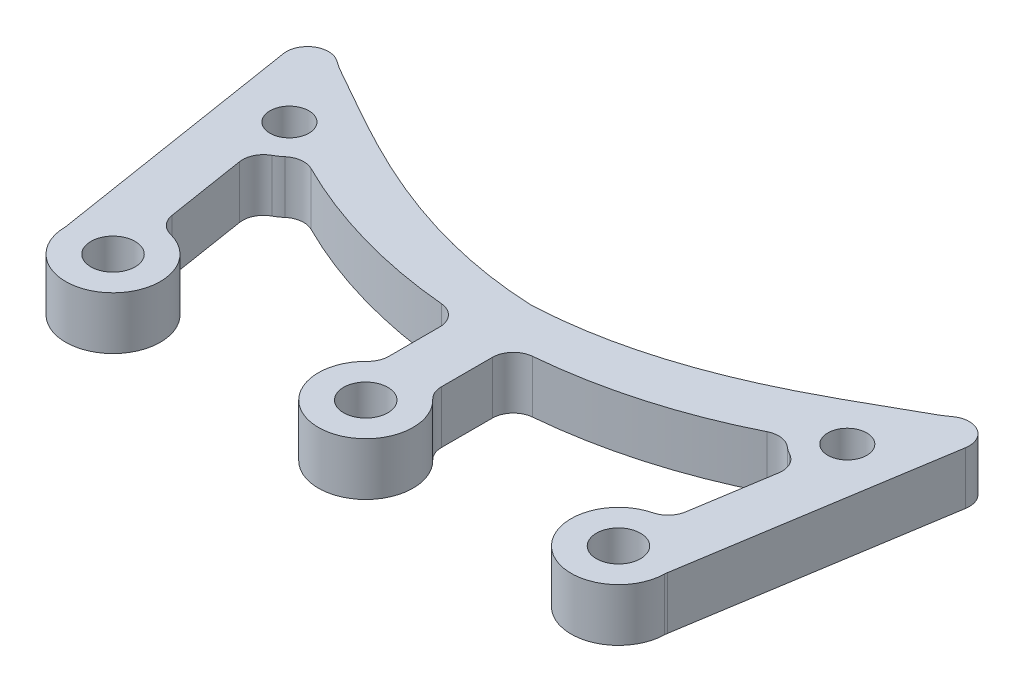
from build123d import *

# Parameters (mm, degrees)
SKETCH1_R           = 2.1
SKETCH1_R_2         = 1.85
BOSS_EXTRUDE1_DEPTH = 5
FILLET1_R           = 2


with BuildPart() as part:
    # Sketch1 → Boss-Extrude1 (new body)
    with BuildSketch(Plane(origin=(0, 0, 0), x_dir=(1, 0, 0), z_dir=(0, 1, 0))):
        with BuildLine():
            Line((64.703578791, 22.153935156), (60.086593503, -6.943643112))
            ThreePointArc((60.086593503, -6.943643112), (52.351867725, -10.071989183), (55.737016108, -2.446157921))
            Line((55.737016108, -2.446157921), (57.44284906, 8.304495315))
            ThreePointArc((57.44284906, 8.304495315), (55.811241442, 8.948588976), (54.605866, 10.222979068))
            ThreePointArc((54.605866, 10.222979068), (44.668654946, 6.187635781), (34.085703384, 4.445999995))
            Line((34.085703384, 4.445999995), (34.085703384, -3.201391143))
            ThreePointArc((34.085703384, -3.201391143), (31.586593503, -11.443643112), (29.087483622, -3.201391143))
            Line((29.087483622, -3.201391143), (29.087483622, 4.445999995))
            ThreePointArc((29.087483622, 4.445999995), (18.504532059, 6.187635781), (8.567321006, 10.222979068))
            ThreePointArc((8.567321006, 10.222979068), (7.361945564, 8.948588976), (5.730337946, 8.304495315))
            Line((5.730337946, 8.304495315), (7.436170898, -2.446157921))
            ThreePointArc((7.436170898, -2.446157921), (10.821319281, -10.071989183), (3.086593503, -6.943643112))
            Line((3.086593503, -6.943643112), (-1.530391785, 22.153935156))
            Line((-1.530391785, 22.153935156), (3.086593503, 19.066758984))
            add(Edge.make_bspline(
                [(3.086593503, 19.066758984), (6.214599524, 17.320565922), (15.289655428, 11.953978367), (24.991497583, 9.011909138), (31.586593503, 8.723848672)],
                knots=[0.224841934, 0.224841934, 0.224841934, 0.224841934, 0.497996304, 1, 1, 1, 1], degree=3))
            add(Edge.make_bspline(
                [(60.086593503, 19.066758984), (56.958587482, 17.320565922), (47.883531578, 11.953978367), (38.181689422, 9.011909138), (31.586593503, 8.723848672)],
                knots=[0.224841934, 0.224841934, 0.224841934, 0.224841934, 0.497996304, 1, 1, 1, 1], degree=3))
            Line((60.086593503, 19.066758984), (64.703578791, 22.153935156))
        make_face()
        with Locations(Location((7.586593503, -6.943643112, 0), (0, 0, 270))):
            Circle(SKETCH1_R, mode=Mode.SUBTRACT)
        with Locations(Location((55.586593503, -6.943643112, 0), (0, 0, 90))):
            Circle(SKETCH1_R, mode=Mode.SUBTRACT)
        with Locations(Location((31.586593503, -6.943643112, 0), (0, 0, 270))):
            Circle(SKETCH1_R, mode=Mode.SUBTRACT)
        with Locations(Location((5.096599352, 12.298499455, 0), (0, 0, 270))):
            Circle(SKETCH1_R_2, mode=Mode.SUBTRACT)
        with Locations(Location((58.076587654, 12.298499455, 0), (0, 0, 270))):
            Circle(SKETCH1_R_2, mode=Mode.SUBTRACT)
    extrude(amount=BOSS_EXTRUDE1_DEPTH)

    # Fillet1
    # the kernel refuses this fillet: 2 mm, written as the material it adds along each edge
    with BuildSketch(Plane(origin=(60.086593503, 0, 6.943643112), x_dir=(0.15671199054579144, 0, -0.9876443449031517), z_dir=(0, 1, 0))) as fillet1_piece_1:
        with BuildLine():
            CenterArc((0.14315588, -2), FILLET1_R, 90, 7.499462887)
            ThreePointArc((-0.117877916, -0.01710783), (-0.058882351, -0.008943954), (0, 0))
            Line((0, 0), (0.14315588, 0))
        make_face()
    extrude(amount=5)
    with BuildSketch(Plane(origin=(55.737016108, 0, 2.446157921), x_dir=(-0.9943134943930577, 0, 0.1064926047566996), z_dir=(0, 1, 0))) as fillet1_piece_2:
        with BuildLine():
            CenterArc((1.536372783, -1.980396143), FILLET1_R, 98.028765666, 66.841966003)
            Line((-0.39430608, -1.458400811), (0, 0))
            ThreePointArc((0, 0), (0.628516139, -0.044108679), (1.257032277, 0))
        make_face()
    extrude(amount=5)
    with BuildSketch(Plane(origin=(57.44284906, 0, -8.304495315), x_dir=(-0.15671199054619364, 0, 0.9876443449030878), z_dir=(0, 1, 0))) as fillet1_piece_3:
        with BuildLine():
            CenterArc((1.659500293, -2), FILLET1_R, 90, 70.676083633)
            ThreePointArc((-0.227825519, -1.338183351), (-0.057363225, -0.678719225), (0, 0))
            Line((0, 0), (1.659500293, 0))
        make_face()
    extrude(amount=5)
    with BuildSketch(Plane(origin=(54.605866, 0, -10.222979068), x_dir=(0.6436684340700369, 0, 0.7653044799175203), z_dir=(0, 1, 0))) as fillet1_piece_4:
        with BuildLine():
            CenterArc((1.610462564, -1.974349834), FILLET1_R, 99.186138147, 67.391276413)
            ThreePointArc((-0.334906336, -1.510087145), (-0.161404643, -0.756385011), (0, 0))
            ThreePointArc((0, 0), (0.645588922, -0.051864251), (1.291177843, 0))
        make_face()
    extrude(amount=5)
    with BuildSketch(Plane(origin=(34.085703384, 0, -4.445999995), x_dir=(0, 0, 1), z_dir=(0, 1, 0))) as fillet1_piece_5:
        with BuildLine():
            CenterArc((1.863012192, 2), FILLET1_R, 185.134308641, 84.865691359)
            ThreePointArc((-0.128963122, 1.821018582), (-0.055872709, 0.911118963), (0, 0))
            Line((0, 0), (1.863012192, 0))
        make_face()
    extrude(amount=5)
    with BuildSketch(Plane(origin=(34.085703384, 0, 3.201391143), x_dir=(0, 0, -1), z_dir=(0, 1, 0))) as fillet1_piece_6:
        with BuildLine():
            CenterArc((0.949017611, -2), FILLET1_R, 90, 46.197810795)
            ThreePointArc((-0.494449952, -0.615658498), (-0.233694925, -0.318695554), (0, 0))
            Line((0, 0), (0.949017611, 0))
        make_face()
    extrude(amount=5)
    with BuildSketch(Plane(origin=(29.087483622, 0, 3.201391143), x_dir=(-0.7796793430593535, 0, 0.6261789855995925), z_dir=(0, 1, 0))) as fillet1_piece_7:
        with BuildLine():
            CenterArc((0.965103801, -1.992287399), FILLET1_R, 95.03341493, 46.197810795)
            Line((-0.594254885, -0.739929428), (0, 0))
            ThreePointArc((0, 0), (0.394815191, -0.017353353), (0.789630383, 0))
        make_face()
    extrude(amount=5)
    with BuildSketch(Plane(origin=(29.087483622, 0, -4.445999995), x_dir=(0, 0, 1), z_dir=(0, 1, 0))) as fillet1_piece_8:
        with BuildLine():
            CenterArc((1.863012192, -2), FILLET1_R, 90, 84.865691359)
            ThreePointArc((-0.128963122, -1.821018582), (-0.055872709, -0.911118963), (0, 0))
            Line((0, 0), (1.863012192, 0))
        make_face()
    extrude(amount=5)
    with BuildSketch(Plane(origin=(5.730337946, 0, -8.304495315), x_dir=(0.9473329914518264, 0, -0.3202502198390094), z_dir=(0, 1, 0))) as fillet1_piece_9:
        with BuildLine():
            CenterArc((1.69310821, -1.971630242), FILLET1_R, 99.661958184, 70.676083633)
            Line((-0.278522032, -1.635960483), (0, 0))
            ThreePointArc((0, 0), (0.678719225, -0.057363225), (1.357438451, 0))
        make_face()
    extrude(amount=5)
    with BuildSketch(Plane(origin=(7.436170898, 0, 2.446157921), x_dir=(-0.15671199054620055, 0, -0.987644344903087), z_dir=(0, 1, 0))) as fillet1_piece_10:
        with BuildLine():
            CenterArc((1.510764777, -2), FILLET1_R, 90, 66.841966003)
            ThreePointArc((-0.32808249, -1.213462824), (-0.121461398, -0.618243674), (0, 0))
            Line((0, 0), (1.510764777, 0))
        make_face()
    extrude(amount=5)
    with BuildSketch(Plane(origin=(3.086593503, 0, 6.943643112), x_dir=(0.013234765762904084, 0, 0.9999124166521791), z_dir=(0, 1, 0))) as fillet1_piece_11:
        with BuildLine():
            CenterArc((0.145582423, -1.999824833), FILLET1_R, 90.75831836, 7.499462887)
            Line((-0.141671624, -0.020561053), (0, 0))
            ThreePointArc((0, 0), (0.059556446, -0.000394125), (0.119112892, 0))
        make_face()
    extrude(amount=5)
    with BuildSketch(Plane(origin=(3.086593503, 0, -19.066758984), x_dir=(-0.831286153352586, 0, -0.5558447006532138), z_dir=(0, 1, 0))) as fillet1_piece_12:
        with BuildLine():
            CenterArc((0.080080644, -2), FILLET1_R, 90, 4.575133674)
            ThreePointArc((-0.079451987, -0.006372818), (-0.039725694, -0.003190148), (0, 0))
            Line((0, 0), (0.080080644, 0))
        make_face()
    extrude(amount=5)
    with BuildSketch(Plane(origin=(31.586593503, 0, -8.723848672), x_dir=(-0.9989968341104656, 0, -0.044780860166667026), z_dir=(0, 1, 0))) as fillet1_piece_13:
        with BuildLine():
            CenterArc((0.089651597, -1.999998688), FILLET1_R, 89.934377151, 5.264470885)
            ThreePointArc((-0.091573518, -0.008226247), (-0.045789115, -0.0040869), (0, 0))
            ThreePointArc((0, 0), (0.045971133, 2.6329e-05), (0.091942266, 0))
        make_face()
    extrude(amount=5)
    with BuildSketch(Plane(origin=(60.086593503, 0, -19.066758984), x_dir=(-0.8730663040204696, 0, 0.4876015061338889), z_dir=(0, 1, 0))) as fillet1_piece_14:
        with BuildLine():
            CenterArc((0.080081519, -1.999999965), FILLET1_R, 90.010724643, 4.575133674)
            Line((-0.079824277, -0.00640268), (0, 0))
            ThreePointArc((0, 0), (0.039853579, -3.751e-06), (0.079707158, 0))
        make_face()
    extrude(amount=5)
    with BuildSketch(Plane(origin=(8.567321006, 0, -10.222979068), x_dir=(0.8865164621041475, 0, 0.46269705252826665), z_dir=(0, 1, 0))) as fillet1_piece_15:
        with BuildLine():
            CenterArc((1.578820312, -1.999743323), FILLET1_R, 90.91795372, 67.391276413)
            ThreePointArc((-0.279563936, -1.260549177), (-0.089148014, -0.64150416), (0, 0))
            ThreePointArc((0, 0), (0.773389527, -0.006195491), (1.546779054, 0))
        make_face()
    extrude(amount=5)
    # the kernel refuses this fillet: 2 mm, written as the material it takes off along each edge
    with BuildSketch(Plane(origin=(64.703578791, -11.440469637, -22.153935156), x_dir=(-0.831286153352585, 0, 0.5558447006532152), z_dir=(0, 1, 0)), Plane(origin=(-1.530391785, -11.440469637, -22.153935156), x_dir=(0.15671199054620674, 0, 0.987644344903086), z_dir=(0, 1, 0))) as fillet1_2_piece_1:
        with BuildLine():
            CenterArc((FILLET1_R * 2.28809392748, FILLET1_R), FILLET1_R, 137.214985003, 132.785014997)
            Line((FILLET1_R * 1.5541863886, FILLET1_R * 1.67924938305), (0, 0))
            Line((0, 0), (FILLET1_R * 2.28809392748, 0))
        make_face()
    extrude(amount=27.880939275, mode=Mode.SUBTRACT)


solid = part.part
